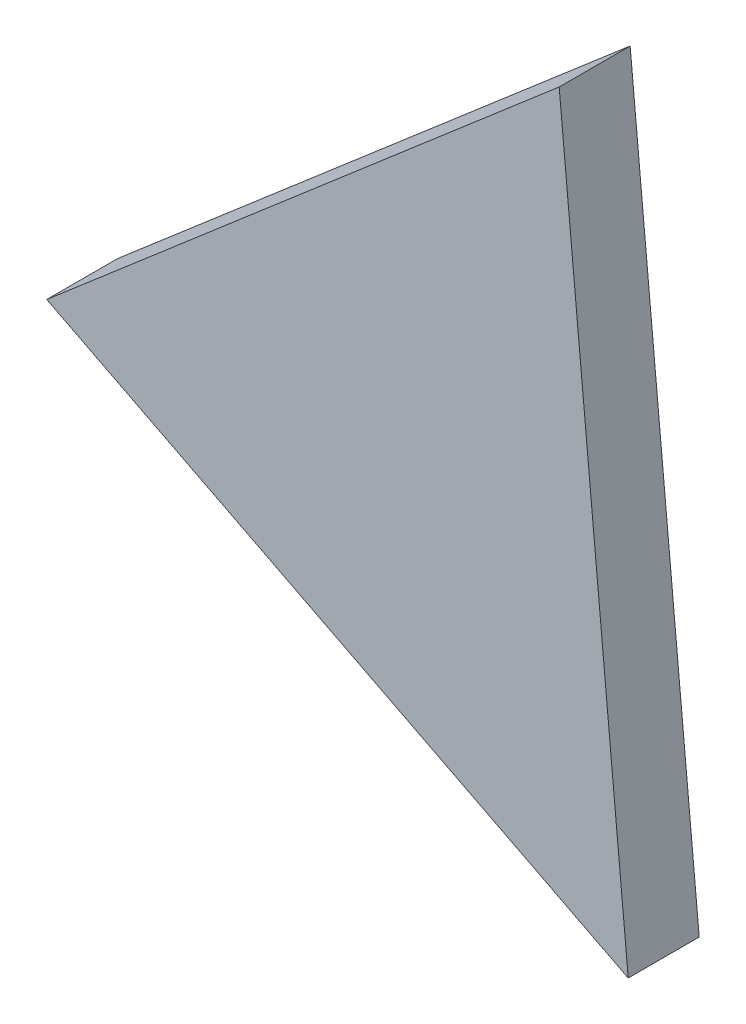
from build123d import *

# Parameters (mm, degrees)
BOSS_EXTRUDE1_DEPTH = 30


with BuildPart() as part:
    # Sketch1 → Boss-Extrude1 (new body)
    with BuildSketch(Plane.XY):
        Polygon((78.419416025, -149.770914829), (49.229142932, 161.73326529), (-167.304299663, -24.299277205), align=None)
    extrude(amount=BOSS_EXTRUDE1_DEPTH)


solid = part.part
